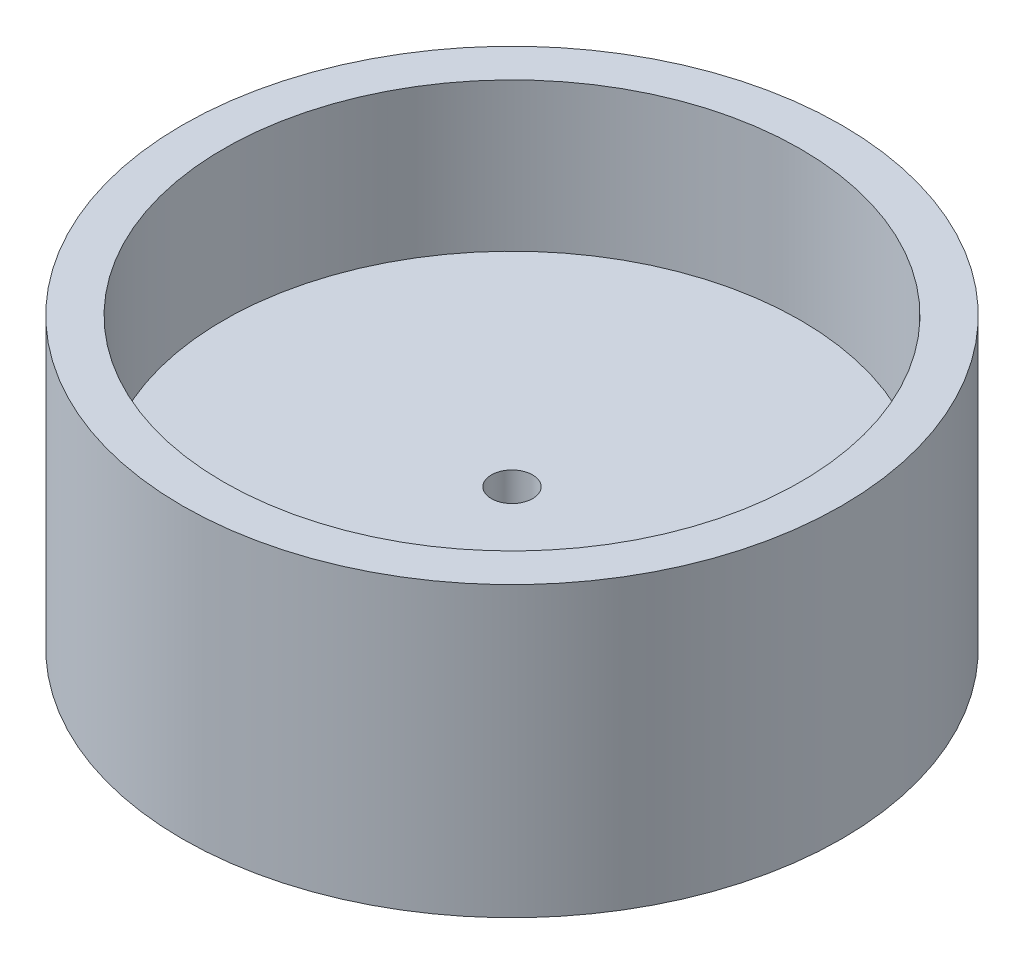
from build123d import *

# Parameters (mm, degrees)
ESQUISSE1_R             = 40
BOSS_EXTRU_2_DEPTH      = 35
ESQUISSE4_R             = 35
ENL_V_MAT_EXTRU_2_DEPTH = 18
ENL_V_START             = -12
ESQUISSE5_R             = 35
ENL_V_MAT_EXTRU_3_DEPTH = 12
ESQUISSE6_R             = 2.5
ENL_V_MAT_EXTRU_4_DEPTH = 12


with BuildPart() as part:
    # Esquisse1 → Boss.-Extru.2 (new body)
    with BuildSketch(Plane(origin=(0, 0, 0), x_dir=(1, 0, 0), z_dir=(0, 1, 0))):
        Circle(ESQUISSE1_R)
    extrude(amount=BOSS_EXTRU_2_DEPTH)

    # Esquisse4 → Enlèv. mat.-Extru.2 (cut)
    with BuildSketch(Plane(origin=(0, 35, 0), x_dir=(1, 0, 0), z_dir=(0, 1, 0))):
        Circle(ESQUISSE4_R)
    extrude(amount=-ENL_V_MAT_EXTRU_2_DEPTH, mode=Mode.SUBTRACT)

    # Esquisse5 → Enlèv. mat.-Extru.3 (cut)
    with BuildSketch(Plane(origin=(0, 0, 0), x_dir=(-1, 0, 0), z_dir=(0, -1, 0)).offset(ENL_V_START)):
        Circle(ESQUISSE5_R)
    extrude(amount=ENL_V_MAT_EXTRU_3_DEPTH, mode=Mode.SUBTRACT)

    # Esquisse6 → Enlèv. mat.-Extru.4 (cut)
    with BuildSketch(Plane(origin=(0, 17, 0), x_dir=(1, 0, 0), z_dir=(0, 1, 0))):
        Circle(ESQUISSE6_R)
    extrude(amount=-ENL_V_MAT_EXTRU_4_DEPTH, mode=Mode.SUBTRACT)


solid = part.part
